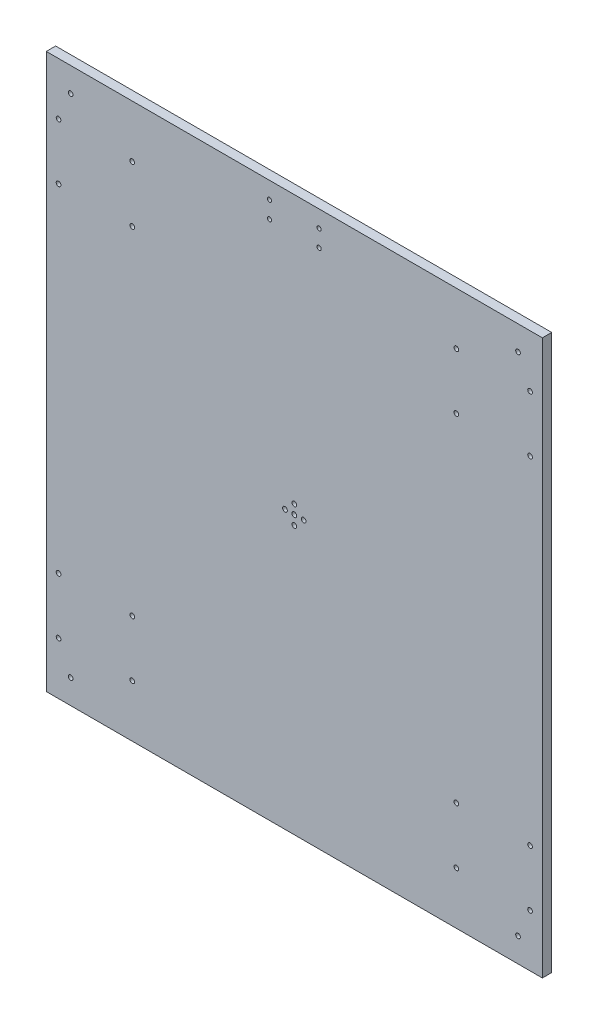
from build123d import *

# Parameters (mm, degrees)
SKETCH_3_W                  = 530
SKETCH_3_H                  = 592.3
SKETCH_3_R                  = 2.55
EXTRUDE_1_DEPTH             = 10
SKETCH_4_R                  = 2.5
CUT_EXTRUDE_1_DEPTH         = 398.529649838
PATTERN_LINEAR_1_COUNT      = 2
PATTERN_LINEAR_1_PITCH      = 478
PATTERN_LINEAR_1_COUNT_DIR2 = 2
PATTERN_LINEAR_1_PITCH_DIR2 = 540.3
SKETCH_7_R                  = 2.25
CUT_EXTRUDE_2_DEPTH         = 398.529649838
SKETCH_8_R                  = 2.5
CUT_EXTRUDE_3_DEPTH         = 398.529649838
PATTERN_LINEAR_2_COUNT      = 2
PATTERN_LINEAR_2_PITCH      = 420.3
PATTERN_LINEAR_2_COUNT_DIR2 = 2
PATTERN_LINEAR_2_PITCH_DIR2 = 424.995


with BuildPart() as part:
    # Эскиз3 → Бобышка-Вытянуть1 (new body)
    with BuildSketch(Plane.XY):
        Rectangle(SKETCH_3_W, SKETCH_3_H)
        Circle(SKETCH_3_R, mode=Mode.SUBTRACT)
        with Locations((0, 10)):
            Circle(SKETCH_3_R, mode=Mode.SUBTRACT)
        with Locations((10, 0)):
            Circle(SKETCH_3_R, mode=Mode.SUBTRACT)
        with Locations((0, -10)):
            Circle(SKETCH_3_R, mode=Mode.SUBTRACT)
        with Locations((-10, 0)):
            Circle(SKETCH_3_R, mode=Mode.SUBTRACT)
    extrude(amount=EXTRUDE_1_DEPTH)

    # Эскиз4 → Вырез-Вытянуть1 (cut, through all)
    with BuildSketch(Plane.XY.offset(10)):
        with Locations((-239, 270.15)):
            Circle(SKETCH_4_R)
    cut_extrude_1 = extrude(amount=-CUT_EXTRUDE_1_DEPTH, mode=Mode.SUBTRACT)

    # Линейный массив1: Cut-Extrude 1 2 × 2
    with Locations(*[(i * PATTERN_LINEAR_1_PITCH, -j * PATTERN_LINEAR_1_PITCH_DIR2, 0) for i in range(PATTERN_LINEAR_1_COUNT) for j in range(PATTERN_LINEAR_1_COUNT_DIR2) if (i, j) != (0, 0)]):
        add(cut_extrude_1, mode=Mode.SUBTRACT)

    # Эскиз7 → Вырез-Вытянуть2 (cut, through all)
    with BuildSketch(Plane(origin=(0, 0, 0), x_dir=(-1, 0, 0), z_dir=(0, 0, -1))):
        with Locations((-26.5, 278.15)):
            Circle(SKETCH_7_R)
        with Locations((26.5, 278.15)):
            Circle(SKETCH_7_R)
        with Locations((-26.5, 260.15)):
            Circle(SKETCH_7_R)
        with Locations((26.5, 260.15)):
            Circle(SKETCH_7_R)
    extrude(amount=-CUT_EXTRUDE_2_DEPTH, mode=Mode.SUBTRACT)

    # Эскиз8 → Вырез-Вытянуть3 (cut, through all)
    with BuildSketch(Plane(origin=(0, 0, 0), x_dir=(-1, 0, 0), z_dir=(0, 0, -1))):
        with Locations((173.125, 180.15)):
            Circle(SKETCH_8_R)
        with Locations((173.125, 240.15)):
            Circle(SKETCH_8_R)
        with Locations((251.875, 240.15)):
            Circle(SKETCH_8_R)
        with Locations((251.875, 180.15)):
            Circle(SKETCH_8_R)
    cut_extrude_3 = extrude(amount=-CUT_EXTRUDE_3_DEPTH, mode=Mode.SUBTRACT)

    # Линейный массив2: Cut-Extrude 3 2 × 2
    with Locations(*[(j * PATTERN_LINEAR_2_PITCH_DIR2, -i * PATTERN_LINEAR_2_PITCH, 0) for i in range(PATTERN_LINEAR_2_COUNT) for j in range(PATTERN_LINEAR_2_COUNT_DIR2) if (i, j) != (0, 0)]):
        add(cut_extrude_3, mode=Mode.SUBTRACT)


solid = part.part
